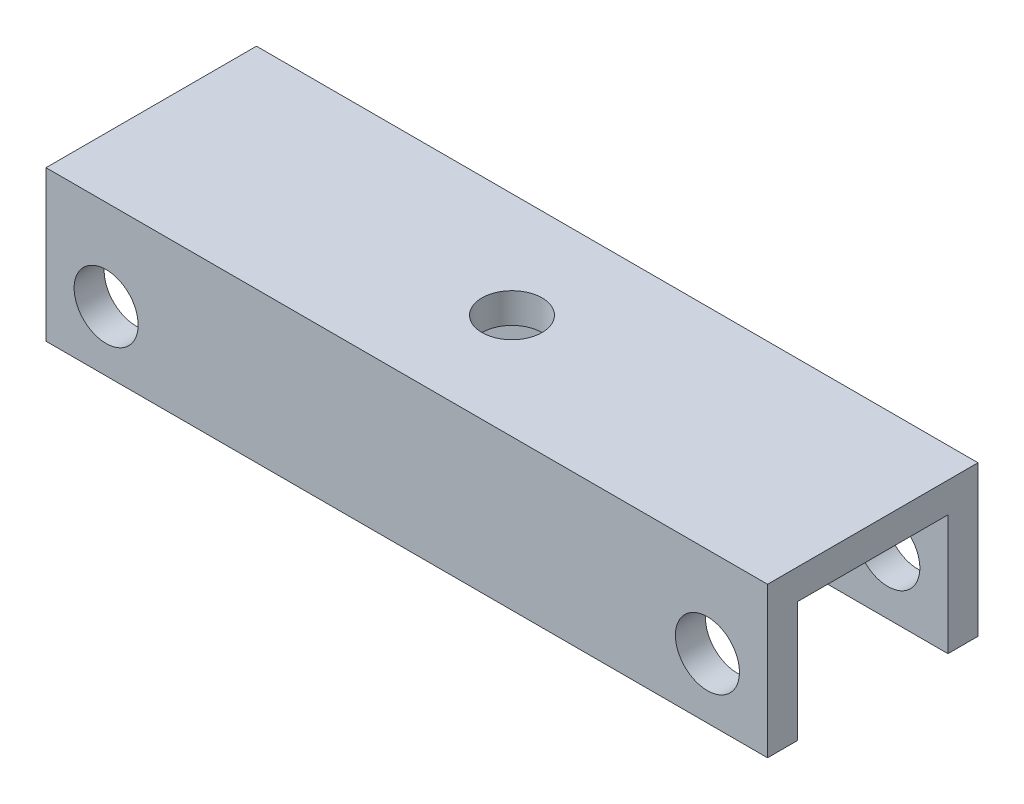
from build123d import *

# Parameters (mm, degrees)
BOSS_EXTRUDE3_DEPTH = 152.4
CUT_EXTRUDE3_REACH  = 161.569
SKETCH7_R           = 6.35
SKETCH8_R           = 6.763254826
CUT_EXTRUDE4_DEPTH  = 162.893869557


with BuildPart() as part:
    # Sketch6 → Boss-Extrude3 (new body)
    with BuildSketch(Plane(origin=(0, 0, 0), x_dir=(0, 0, -1), z_dir=(1, 0, 0))):
        Polygon((-35.048704326, 0), (9.401295674, 0), (9.401295674, -31.75), (3.051295674, -31.75), (3.051295674, -6.35), (-28.698704326, -6.35), (-28.698704326, -31.75), (-35.048704326, -31.75), align=None)
    extrude(amount=BOSS_EXTRUDE3_DEPTH)

    # Sketch7 → Cut-Extrude3 (cut, up to next)
    with BuildSketch(Plane(origin=(0, 0, 0), x_dir=(1, 0, 0), z_dir=(0, 1, 0)), mode=Mode.PRIVATE) as cut_extrude3_sk1:
        with Locations((76.2, -12.823704326)):
            Circle(SKETCH7_R)
    cut_extrude3_tool1 = extrude(cut_extrude3_sk1.sketch, amount=-CUT_EXTRUDE3_REACH, mode=Mode.PRIVATE) & part.part
    add(cut_extrude3_tool1.solids().sort_by_distance((76.2, 0, 12.823704))[0], mode=Mode.SUBTRACT)

    # Sketch8 → Cut-Extrude4 (cut, through all)
    with BuildSketch(Plane.XY.offset(35.048704326)):
        with Locations((12.7, -19.05)):
            Circle(SKETCH8_R)
        with Locations((139.7, -19.05)):
            Circle(SKETCH8_R)
    extrude(amount=-CUT_EXTRUDE4_DEPTH, mode=Mode.SUBTRACT)


solid = part.part
